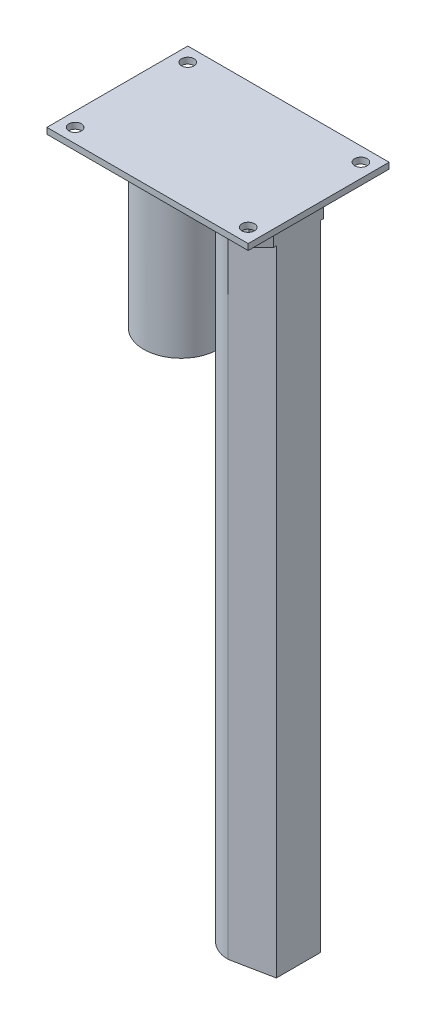
from build123d import *

# Parameters (mm, degrees)
SKETCH_1_W                  = 100
SKETCH_1_H                  = 70
EXTRUDE_1_DEPTH             = 3
SKETCH_2_R                  = 3.1
CUT_EXTRUDE_1_DEPTH         = 62.10646447
PATTERN_LINEAR_2_COUNT      = 2
PATTERN_LINEAR_2_PITCH      = 56
PATTERN_LINEAR_2_COUNT_DIR2 = 2
PATTERN_LINEAR_2_PITCH_DIR2 = 86
EXTRUDE_2_DEPTH             = 15
CHAMFER_2_SIZE              = 6
SKETCH_4_R                  = 18.5
EXTRUDE_3_DEPTH             = 70
EXTRUDE_4_DEPTH             = 315
SHELL_START                 = -327
SHELL_5_DEPTH               = 327
SHELL_START_2               = -82
SHELL_5_2_OUTLINE_R         = 15.5
SHELL_5_2_DEPTH             = 82
SHELL_START_3               = -12
SHELL_5_3_DEPTH             = 12
CUT_EXTRUDE_2_REACH         = 340.547
SKETCH_6_R                  = 10


# Read off the part's stored shape, not the designer's step: 抽壳5
with BuildPart() as part:
    # 草图1 → 凸台-拉伸1 (new body)
    with BuildSketch(Plane(origin=(0, 0, 0), x_dir=(1, 0, 0), z_dir=(0, 1, 0))):
        Rectangle(SKETCH_1_W, SKETCH_1_H)
    extrude(amount=EXTRUDE_1_DEPTH)

    # 草图2 → 切除-拉伸1 (cut, through all)
    with BuildSketch(Plane(origin=(0, 3, 0), x_dir=(1, 0, 0), z_dir=(0, 1, 0))):
        with Locations(Location((-43, 28, 0), (0, 0, 270))):
            Circle(SKETCH_2_R)
    cut_extrude_1 = extrude(amount=-CUT_EXTRUDE_1_DEPTH, mode=Mode.SUBTRACT)

    # 阵列(线性)2: Cut-Extrude 1 2 × 2
    with Locations(*[(j * PATTERN_LINEAR_2_PITCH_DIR2, 0, i * PATTERN_LINEAR_2_PITCH) for i in range(PATTERN_LINEAR_2_COUNT) for j in range(PATTERN_LINEAR_2_COUNT_DIR2) if (i, j) != (0, 0)]):
        add(cut_extrude_1, mode=Mode.SUBTRACT)

    # 草图3 → 凸台-拉伸2 (add)
    with BuildSketch(Plane.XZ):
        with BuildLine():
            Line((-18.4, 18.5), (40, 18.5))
            Line((40, 18.5), (40, -18.5))
            Line((40, -18.5), (-18.4, -18.5))
            ThreePointArc((-18.4, -18.5), (-36.9, 0), (-18.4, 18.5))
        make_face()
    extrude(amount=EXTRUDE_2_DEPTH)

    # 倒角2
    chamfer_2_edges = [part.edges().sort_by_distance(p)[0] for p in [
        (40, -7.5, -18.5),
        (40, -7.5, 18.5),
    ]]
    chamfer(chamfer_2_edges, length=CHAMFER_2_SIZE)

    # 草图4 → 凸台-拉伸3 (add)
    with BuildSketch(Plane(origin=(0, -15, 0), x_dir=(-1, 0, 0), z_dir=(0, -1, 0))):
        with Locations(Location((18.4, 0, 0), (0, 0, 90))):
            Circle(SKETCH_4_R)
    extrude(amount=EXTRUDE_3_DEPTH)

    # 草图5 → 凸台-拉伸4 (add)
    with BuildSketch(Plane.XZ.offset(15)):
        with BuildLine():
            ThreePointArc((20, -15), (5, 0), (20, 15))
            Line((20, 15), (20, -15))
        make_face()
        Polygon((20, -15), (40, -11), (40, 11), (20, 15), align=None)
    extrude(amount=EXTRUDE_4_DEPTH)

    # 抽壳5 outline → 抽壳5 (cut)
    with BuildSketch(Plane(origin=(0, 0, 0), x_dir=(1, 0, 0), z_dir=(0, 1, 0)).offset(SHELL_START)):
        with BuildLine():
            Line((37, -8.540588292), (37, 8.540588292))
            Line((37, 8.540588292), (19.719352649, 11.996717762))
            ThreePointArc((19.719352649, 11.996717762), (8, 0), (19.719352649, -11.996717762))
            Line((19.719352649, -11.996717762), (37, -8.540588292))
        make_face()
    extrude(amount=SHELL_5_DEPTH, mode=Mode.SUBTRACT)

    # Shell 5 2 outline → Shell 5 2 (cut)
    with BuildSketch(Plane(origin=(0, 0, 0), x_dir=(1, 0, 0), z_dir=(0, 1, 0)).offset(SHELL_START_2)):
        with Locations((-18.4, 0)):
            Circle(SHELL_5_2_OUTLINE_R)
    extrude(amount=SHELL_5_2_DEPTH, mode=Mode.SUBTRACT)

    # Shell 5 3 outline → Shell 5 3 (cut)
    with BuildSketch(Plane(origin=(0, 0, 0), x_dir=(1, 0, 0), z_dir=(0, 1, 0)).offset(SHELL_START_3)):
        with BuildLine():
            Line((32.757359313, 15.5), (-18.4, 15.5))
            ThreePointArc((-18.4, 15.5), (-2.9, 0), (-18.4, -15.5))
            Line((-18.4, -15.5), (32.757359313, -15.5))
            Line((32.757359313, -15.5), (37, -11.257359313))
            Line((37, -11.257359313), (37, -8.540588292))
            Line((37, -8.540588292), (19.719352649, -11.996717762))
            ThreePointArc((19.719352649, -11.996717762), (8, 0), (19.719352649, 11.996717762))
            Line((19.719352649, 11.996717762), (37, 8.540588292))
            Line((37, 8.540588292), (37, 11.257359313))
            Line((37, 11.257359313), (32.757359313, 15.5))
        make_face()
    extrude(amount=SHELL_5_3_DEPTH, mode=Mode.SUBTRACT)

    # 草图6 → 切除-拉伸2 (cut, up to next)
    with BuildSketch(Plane.XZ.offset(330), mode=Mode.PRIVATE) as cut_extrude_2_sk1:
        with Locations(Location((20, 0, 0), (0, 0, 270))):
            Circle(SKETCH_6_R)
    cut_extrude_2_tool1 = extrude(cut_extrude_2_sk1.sketch, amount=-CUT_EXTRUDE_2_REACH, mode=Mode.PRIVATE) & part.part
    add(cut_extrude_2_tool1.solids().sort_by_distance((20, -330, 0))[0], mode=Mode.SUBTRACT)


solid = part.part
